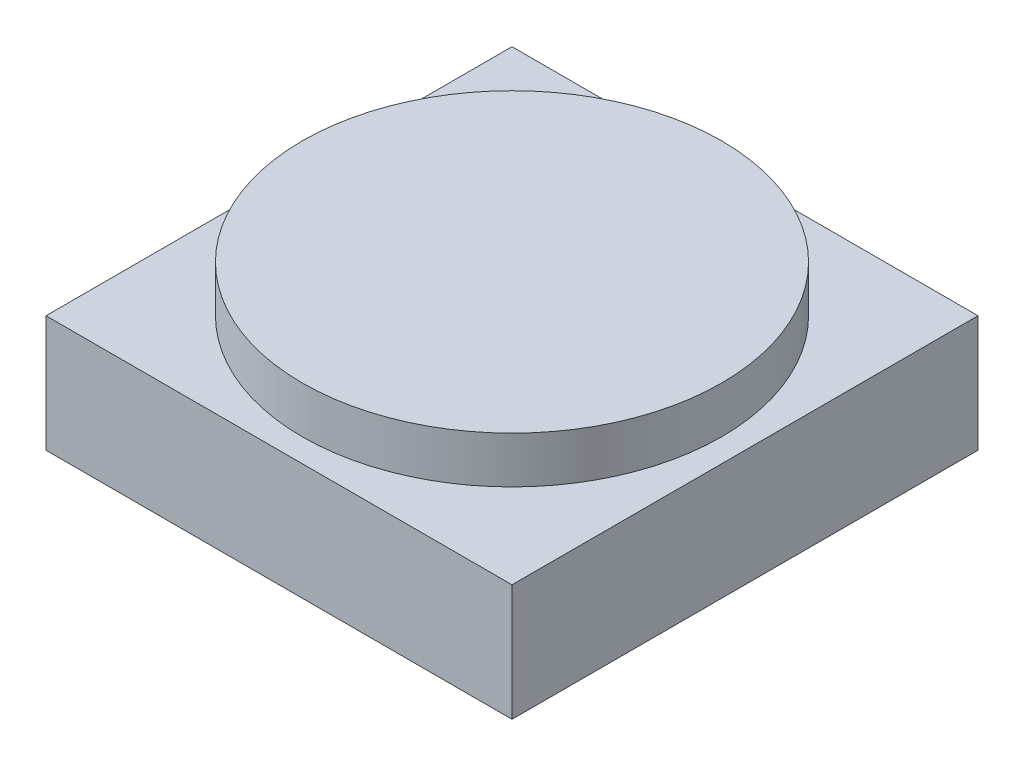
from build123d import *

# Parameters (mm, degrees)
SKETCH2_W           = 31.75
SKETCH2_H           = 31.75
BOSS_EXTRUDE1_DEPTH = 7.9375
SKETCH3_R           = 14.2875
BOSS_EXTRUDE2_DEPTH = 3.175


with BuildPart() as part:
    # Sketch2 → Boss-Extrude1 (new body)
    with BuildSketch(Plane(origin=(0, 0, 0), x_dir=(1, 0, 0), z_dir=(0, 1, 0))):
        Rectangle(SKETCH2_W, SKETCH2_H)
    extrude(amount=BOSS_EXTRUDE1_DEPTH)


with BuildPart() as body_2:
    # Sketch3 → Boss-Extrude2 (new body)
    with BuildSketch(Plane(origin=(0, 7.9375, 0), x_dir=(1, 0, 0), z_dir=(0, 1, 0))):
        Circle(SKETCH3_R)
    extrude(amount=BOSS_EXTRUDE2_DEPTH)


solid = Compound([part.part, body_2.part])
